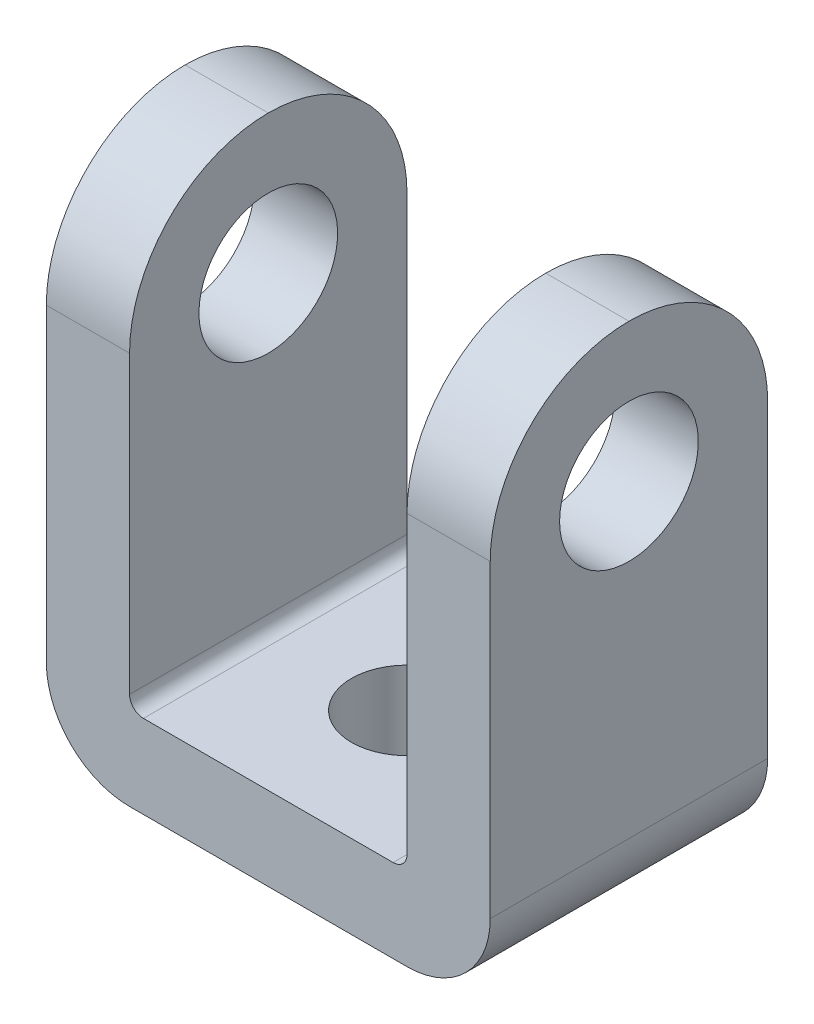
from build123d import *

# Parameters (mm, degrees)
BOSS_EXTRUDE1_DEPTH = 10
SKETCH2_R           = 2.5
CUT_EXTRUDE1_DEPTH  = 27.882385658
CUT_EXTRUDE2_REACH  = 26.835
SKETCH3_R           = 2
FILLET1_R           = 5
FILLET2_R           = 3
FILLET3_R           = 0.5


with BuildPart() as part:
    # Sketch1 → Boss-Extrude1 (new body)
    with BuildSketch(Plane.XY):
        Polygon((13, 0), (16, 0), (16, -19.1484375), (0, -19.1484375), (0, 0), (3, 0), (3, -16.1484375), (13, -16.1484375), align=None)
    extrude(amount=BOSS_EXTRUDE1_DEPTH)

    # Sketch2 → Cut-Extrude1 (cut, through all)
    with BuildSketch(Plane.ZY):
        with Locations((5, -5)):
            Circle(SKETCH2_R)
    extrude(amount=-CUT_EXTRUDE1_DEPTH, mode=Mode.SUBTRACT)

    # Sketch3 → Cut-Extrude2 (cut, up to next)
    with BuildSketch(Plane(origin=(0, -16.1484375, 0), x_dir=(1, 0, 0), z_dir=(0, 1, 0)), mode=Mode.PRIVATE) as cut_extrude2_sk1:
        with Locations(Location((8, -5, 0), (0, 0, 270))):
            Circle(SKETCH3_R)
    cut_extrude2_tool1 = extrude(cut_extrude2_sk1.sketch, amount=-CUT_EXTRUDE2_REACH, mode=Mode.PRIVATE) & part.part
    add(cut_extrude2_tool1.solids().sort_by_distance((8, -16.148438, 5))[0], mode=Mode.SUBTRACT)

    # Fillet1
    fillet1_edges = [part.edges().sort_by_distance(p)[0] for p in [
        (14.5, 0, 10),
        (14.5, 0, 0),
        (1.5, 0, 0),
        (1.5, 0, 10),
    ]]
    fillet(fillet1_edges, radius=FILLET1_R - 0.0001)  # a hair under: the kernel refuses the full size

    # Fillet2
    fillet2_edges = [part.edges().sort_by_distance(p)[0] for p in [
        (16, -19.1484375, 5),
        (0, -19.1484375, 5),
    ]]
    fillet(fillet2_edges, radius=FILLET2_R)

    # Fillet3
    fillet3_edges = [part.edges().sort_by_distance(p)[0] for p in [
        (3, -16.1484375, 5),
        (13, -16.1484375, 5),
    ]]
    fillet(fillet3_edges, radius=FILLET3_R)


solid = part.part
